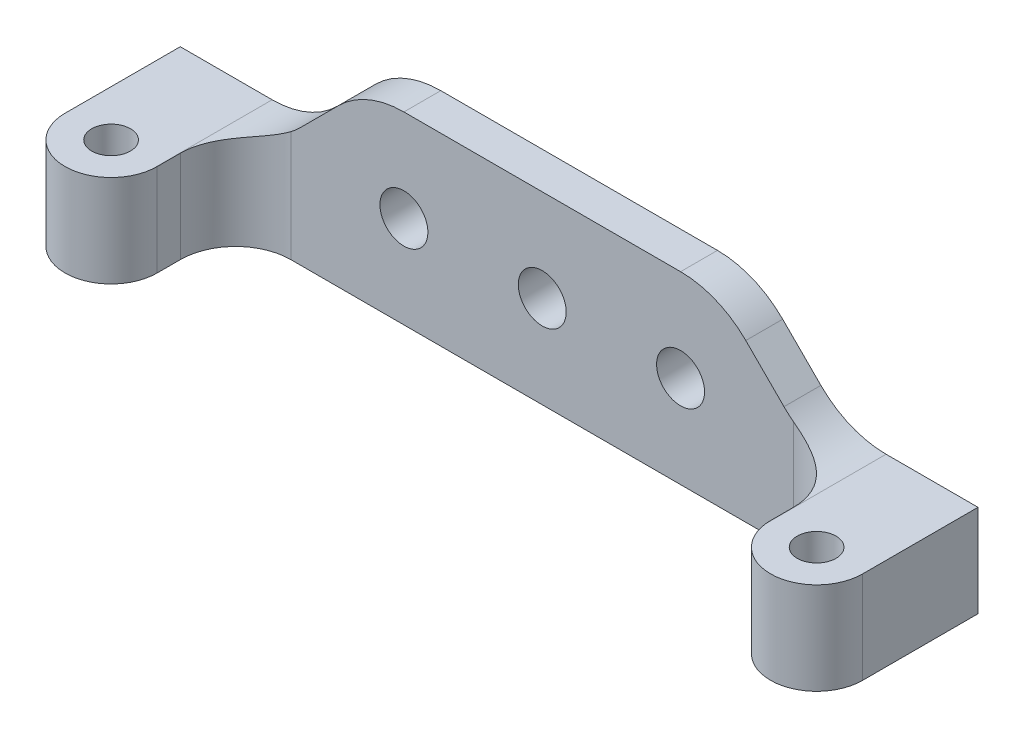
from build123d import *
from build123d.topology import SkipClean

# Parameters (mm, degrees)
SKETCH1_R           = 2.1
BOSS_EXTRUDE1_DEPTH = 20
SKETCH3_R           = 2.6
BOSS_EXTRUDE2_DEPTH = 17.5


with BuildPart() as part:
    # Sketch1 → Boss-Extrude1 (new body)
    with BuildSketch(Plane(origin=(0, 0, 0), x_dir=(1, 0, 0), z_dir=(0, 1, 0))):
        with BuildLine():
            Line((-7.75, -12.5), (-7.75, 0))
            Line((-7.75, 0), (-51, 0))
            Line((-51, 0), (-51, -4))
            Line((-51, -4), (-23.75, -4))
            ThreePointArc((-23.75, -4), (-19.507359313, -5.757359313), (-17.75, -10))
            Line((-17.75, -10), (-17.75, -12.5))
            ThreePointArc((-17.75, -12.5), (-12.75, -17.5), (-7.75, -12.5))
        make_face()
        with Locations(Location((-12.75, -12.5, 0), (0, 0, 270))):
            Circle(SKETCH1_R, mode=Mode.SUBTRACT)
    extrude(amount=BOSS_EXTRUDE1_DEPTH)


with BuildPart() as body_2:
    # Sketch3 → Boss-Extrude2 (new, through all)
    with BuildSketch(Plane.XY):
        with BuildLine():
            Line((-51, 0), (-7.75, 0))
            Line((-7.75, 0), (-7.75, 10))
            Line((-7.75, 10), (-17.715728753, 10))
            ThreePointArc((-17.715728753, 10), (-21.542563076, 10.761204675), (-24.786796564, 12.928932188))
            Line((-24.786796564, 12.928932188), (-28.928932188, 17.071067812))
            ThreePointArc((-28.928932188, 17.071067812), (-32.173165676, 19.238795325), (-36, 20))
            Line((-36, 20), (-51, 20))
            Line((-51, 20), (-51, 12.6))
            ThreePointArc((-51, 12.6), (-49.161522369, 11.838477631), (-48.4, 10))
            ThreePointArc((-48.4, 10), (-49.161522369, 8.161522369), (-51, 7.4))
            Line((-51, 7.4), (-51, 0))
        make_face()
        with Locations((-36, 10)):
            Circle(SKETCH3_R, mode=Mode.SUBTRACT)
    extrude(amount=BOSS_EXTRUDE2_DEPTH)

    # Intersect1: read off the stored shape, not the designer's step
    # Intersect1: intersect part
    add(part.part, mode=Mode.INTERSECT)

    # Mirror1: body 2 across face


with BuildPart() as body_2_1:
    with SkipClean():  # the faces are left unmerged after this step: merging them gives an invalid solid
        add(body_2.part)
        add(body_2.part.mirror(Plane(origin=(-51, 16.3, 2), x_dir=(0, 0, 1), z_dir=(-1, 0, 0))))


solid = body_2_1.part
